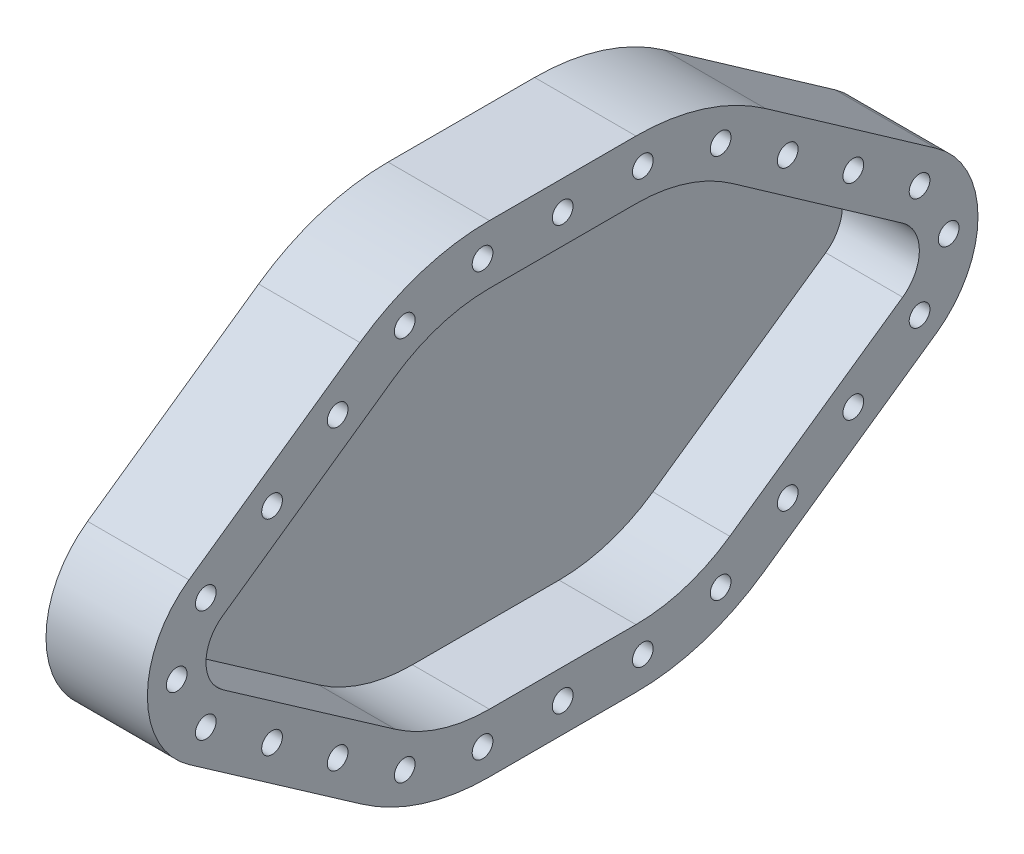
from build123d import *

# Parameters (mm, degrees)
BOSS_EXTRUDE1_DEPTH    = 26.35
CUT_EXTRUDE1_DEPTH     = 20
CUT_EXTRUDE3_START     = -26.35
CUT_EXTRUDE3_OUTLINE_R = 2.69253261
CUT_EXTRUDE3_DEPTH     = 26.35


# Read off the part's stored shape, not the designer's step: Cut-Extrude3
with BuildPart() as part:
    # Sketch1 → Boss-Extrude1 (new body)
    with BuildSketch(Plane(origin=(0, 0, 0), x_dir=(0, 0, -1), z_dir=(1, 0, 0))):
        with BuildLine():
            Line((19.05, 62.611), (-19.05, 62.611))
            ThreePointArc((-19.05, 62.611), (-36.688219036, 59.891543079), (-52.688239169, 51.985749479))
            Line((-52.688239169, 51.985749479), (-97.140382944, 20.791361801))
            ThreePointArc((-97.140382944, 20.791361801), (-107.949982522, -0.029797308), (-97.091561196, -20.82553716))
            Line((-97.091561196, -20.82553716), (-52.170359894, -52.19204611))
            ThreePointArc((-52.170359894, -52.19204611), (-36.41024798, -59.944824567), (-19.05, -62.611))
            Line((-19.05, -62.611), (19.05, -62.611))
            ThreePointArc((19.05, -62.611), (36.41024798, -59.944824567), (52.170359894, -52.19204611))
            Line((52.170359894, -52.19204611), (97.091561196, -20.82553716))
            ThreePointArc((97.091561196, -20.82553716), (107.949982522, -0.029797308), (97.140382944, 20.791361801))
            Line((97.140382944, 20.791361801), (52.688239169, 51.985749479))
            ThreePointArc((52.688239169, 51.985749479), (36.688219036, 59.891543079), (19.05, 62.611))
        make_face()
    extrude(amount=BOSS_EXTRUDE1_DEPTH)

    # Sketch2 → Cut-Extrude1 (cut)
    with BuildSketch(Plane(origin=(26.35, 0, 0), x_dir=(0, 0, -1), z_dir=(1, 0, 0))):
        with BuildLine():
            Line((19.05, 47.371), (-19.05, 47.371))
            ThreePointArc((-19.05, 47.371), (-32.09793649, 45.359271881), (-43.934009402, 39.510932398))
            Line((-43.934009402, 39.510932398), (-88.386153178, 8.31654472))
            ThreePointArc((-88.386153178, 8.31654472), (-92.709993009, -0.011918923), (-88.366624478, -8.330214864))
            Line((-88.366624478, -8.330214864), (-43.445423176, -39.696723814))
            ThreePointArc((-43.445423176, -39.696723814), (-31.837016725, -45.407178406), (-19.05, -47.371))
            Line((-19.05, -47.371), (19.05, -47.371))
            ThreePointArc((19.05, -47.371), (31.837016725, -45.407178406), (43.445423176, -39.696723814))
            Line((43.445423176, -39.696723814), (88.366624478, -8.330214864))
            ThreePointArc((88.366624478, -8.330214864), (92.709993009, -0.011918923), (88.386153178, 8.31654472))
            Line((88.386153178, 8.31654472), (43.934009402, 39.510932398))
            ThreePointArc((43.934009402, 39.510932398), (32.09793649, 45.359271881), (19.05, 47.371))
        make_face()
    extrude(amount=-CUT_EXTRUDE1_DEPTH, mode=Mode.SUBTRACT)

    # Cut-Extrude3 outline → Cut-Extrude3 (cut)
    with BuildSketch(Plane(origin=(26.35, 0, 0), x_dir=(0, 0, -1), z_dir=(1, 0, 0)).offset(CUT_EXTRUDE3_START)):
        with Locations((0, 54.991)):
            Circle(CUT_EXTRUDE3_OUTLINE_R)
        with Locations((20.828, 54.959960993)):
            Circle(CUT_EXTRUDE3_OUTLINE_R)
        with Locations((41.055062572, 49.992917233)):
            Circle(CUT_EXTRUDE3_OUTLINE_R)
        with Locations((58.492960359, 38.603215535)):
            Circle(CUT_EXTRUDE3_OUTLINE_R)
        with Locations((75.541877036, 26.639101521)):
            Circle(CUT_EXTRUDE3_OUTLINE_R)
        with Locations((92.763268061, 14.553953261)):
            Circle(CUT_EXTRUDE3_OUTLINE_R)
        with Locations((100.329987765, -0.020858116)):
            Circle(CUT_EXTRUDE3_OUTLINE_R)
        with Locations((92.763268061, -14.553953261)):
            Circle(CUT_EXTRUDE3_OUTLINE_R)
        with Locations((-20.828, 54.959960993)):
            Circle(CUT_EXTRUDE3_OUTLINE_R)
        with Locations((-41.055062572, 49.992917233)):
            Circle(CUT_EXTRUDE3_OUTLINE_R)
        with Locations((-58.492960359, 38.603215535)):
            Circle(CUT_EXTRUDE3_OUTLINE_R)
        with Locations((-75.541877036, 26.639101521)):
            Circle(CUT_EXTRUDE3_OUTLINE_R)
        with Locations((-92.763268061, 14.553953261)):
            Circle(CUT_EXTRUDE3_OUTLINE_R)
        with Locations((-100.329987765, -0.020858116)):
            Circle(CUT_EXTRUDE3_OUTLINE_R)
        with Locations((-92.763268061, -14.553953261)):
            Circle(CUT_EXTRUDE3_OUTLINE_R)
        with Locations((-75.541877036, -26.639101521)):
            Circle(CUT_EXTRUDE3_OUTLINE_R)
        with Locations((-58.492960359, -38.603215535)):
            Circle(CUT_EXTRUDE3_OUTLINE_R)
        with Locations((-41.055062572, -49.992917233)):
            Circle(CUT_EXTRUDE3_OUTLINE_R)
        with Locations((-20.828, -54.959960993)):
            Circle(CUT_EXTRUDE3_OUTLINE_R)
        with Locations((0, -54.991)):
            Circle(CUT_EXTRUDE3_OUTLINE_R)
        with Locations((20.828, -54.959960993)):
            Circle(CUT_EXTRUDE3_OUTLINE_R)
        with Locations((41.055062572, -49.992917233)):
            Circle(CUT_EXTRUDE3_OUTLINE_R)
        with Locations((58.492960359, -38.603215535)):
            Circle(CUT_EXTRUDE3_OUTLINE_R)
        with Locations((75.541877036, -26.639101521)):
            Circle(CUT_EXTRUDE3_OUTLINE_R)
    extrude(amount=CUT_EXTRUDE3_DEPTH, mode=Mode.SUBTRACT)


solid = part.part
